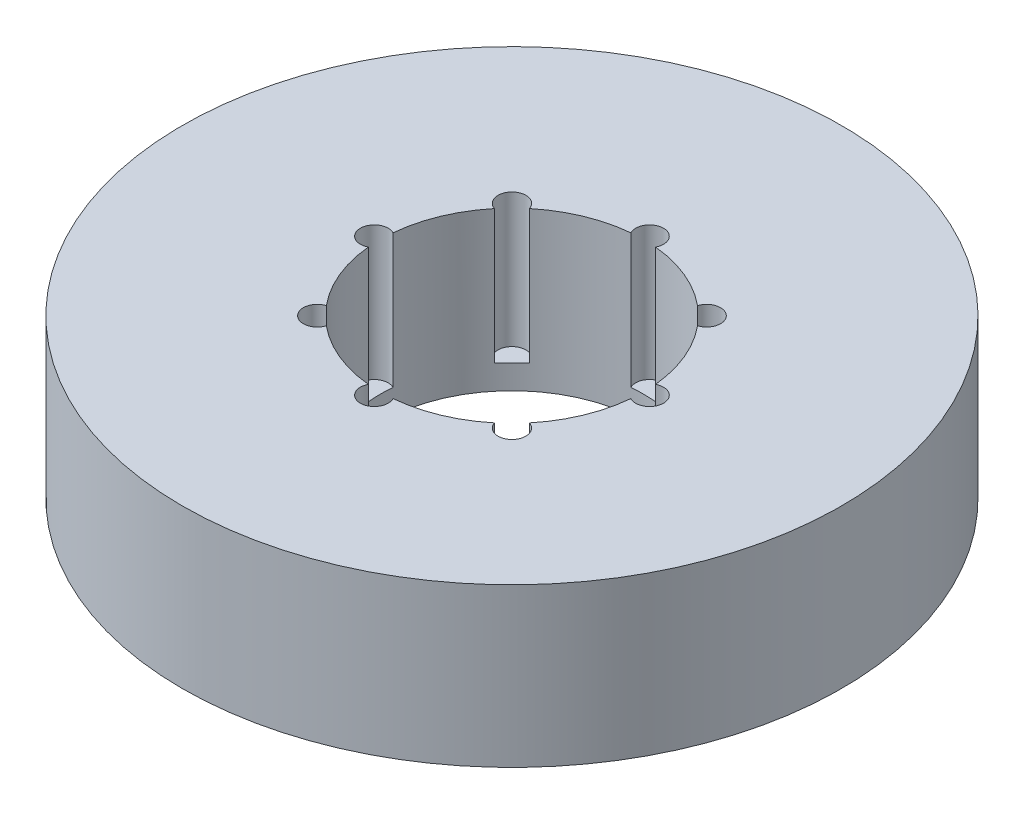
from build123d import *

# Parameters (mm, degrees)
SKETCH1_R           = 62.5
BOSS_EXTRUDE1_DEPTH = 30
SKETCH2_R           = 25
CUT_EXTRUDE1_DEPTH  = 94.340773513
SKETCH3_R           = 2.640439934
CUT_EXTRUDE2_DEPTH  = 25.399254146
CIRPATTERN1_COUNT   = 8


with BuildPart() as part:
    # Sketch1 → Boss-Extrude1 (new body)
    with BuildSketch(Plane(origin=(0, 0, 0), x_dir=(1, 0, 0), z_dir=(0, 1, 0))):
        Circle(SKETCH1_R)
    extrude(amount=BOSS_EXTRUDE1_DEPTH)

    # Sketch2 → Cut-Extrude1 (cut, through all)
    with BuildSketch(Plane(origin=(0, 0, 0), x_dir=(1, 0, 0), z_dir=(0, 1, 0))):
        Circle(SKETCH2_R)
    extrude(amount=CUT_EXTRUDE1_DEPTH, mode=Mode.SUBTRACT)

    # Sketch3 → Cut-Extrude2 (cut)
    with BuildSketch(Plane(origin=(0, 30, 0), x_dir=(1, 0, 0), z_dir=(0, 1, 0))):
        with Locations((-26.106370388, 0)):
            Circle(SKETCH3_R)
    cut_extrude2 = extrude(amount=-CUT_EXTRUDE2_DEPTH, mode=Mode.SUBTRACT)

    # CirPattern1: Cut-Extrude2 ×8 about axis
    cirpattern1_axis = Axis((0, 0, 0), (0, 1, 0))
    for i in range(1, CIRPATTERN1_COUNT):
        add(cut_extrude2.rotate(cirpattern1_axis, i * 360 / CIRPATTERN1_COUNT), mode=Mode.SUBTRACT)


solid = part.part
